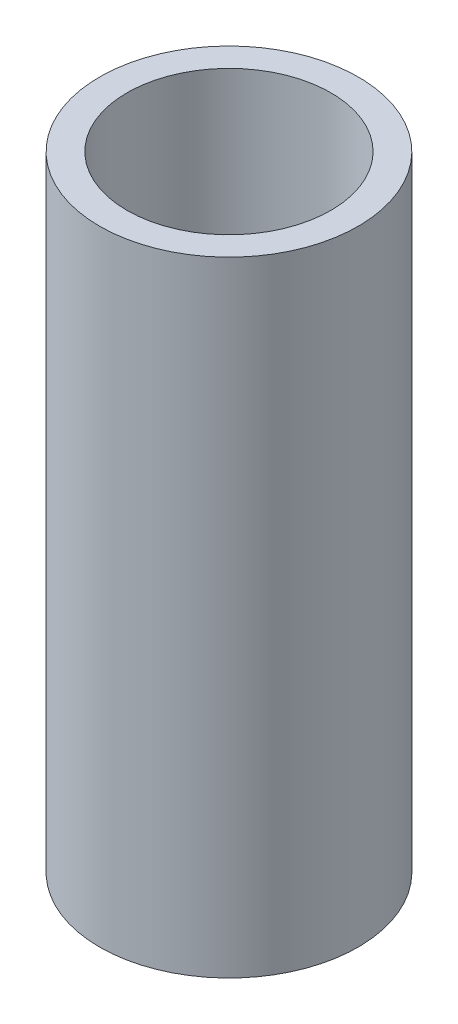
from build123d import *

# Parameters (mm, degrees)
CROQUIS1_R              = 14.5
CROQUIS1_R_2            = 11.43
SALIENTE_EXTRUIR1_DEPTH = 35


with BuildPart() as part:
    # Croquis1 → Saliente-Extruir1 (new, symmetric)
    with BuildSketch(Plane(origin=(0, 0, 0), x_dir=(1, 0, 0), z_dir=(0, 1, 0))):
        Circle(CROQUIS1_R)
        Circle(CROQUIS1_R_2, mode=Mode.SUBTRACT)
    extrude(amount=SALIENTE_EXTRUIR1_DEPTH, both=True)


solid = part.part
